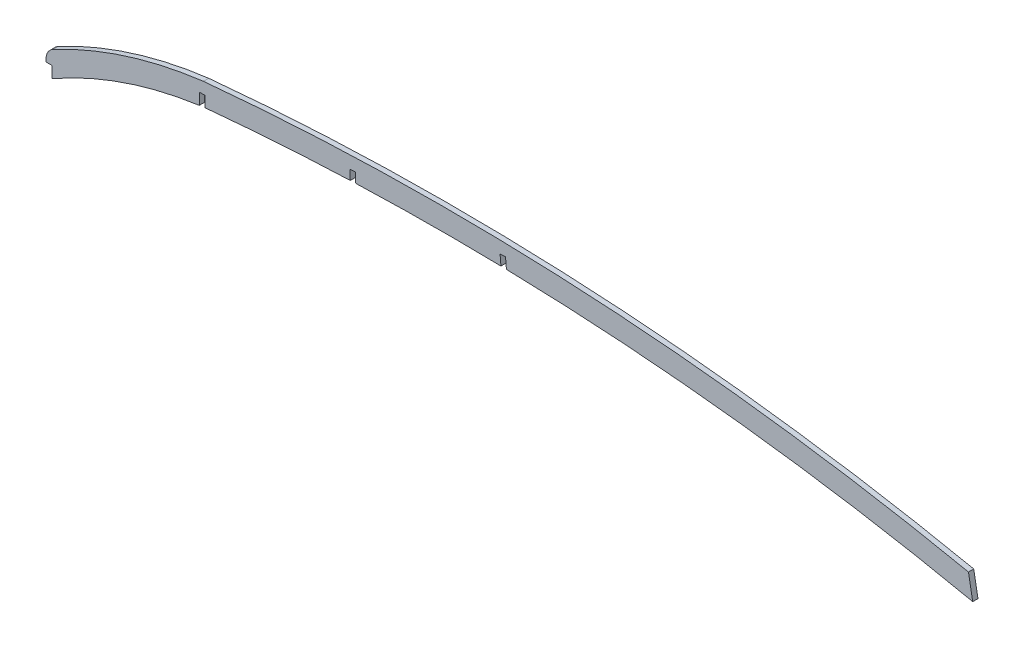
from build123d import *

# Parameters (mm, degrees)
BOSS_EXTRUDE1_DEPTH = 1.5875


with BuildPart() as part:
    # Sketch1 → Boss-Extrude1 (new, symmetric)
    with BuildSketch(Plane.XY):
        with BuildLine():
            Line((0, 101.6), (0, 100.055269774))
            Line((0, 100.055269774), (3.749926944, 100.055269774))
            Line((3.749926944, 100.055269774), (3.749926944, 93.197269774))
            ThreePointArc((3.749926944, 93.197269774), (46.592607477, 112.602219611), (92.329, 123.567152459))
            Line((92.329, 123.567152459), (92.329, 130.517973266))
            Line((92.329, 130.517973266), (95.631, 130.517973266))
            Line((95.631, 130.517973266), (95.631, 124.010897007))
            ThreePointArc((95.631, 124.010897007), (95.971054745, 124.054032816), (96.311168805, 124.096698424))
            ThreePointArc((96.311168805, 124.096698424), (139.761460521, 127.601280315), (183.294042864, 129.86495412))
            Line((183.294042864, 129.86495412), (183.050163268, 135.689672274))
            Line((183.050163268, 135.689672274), (186.349272737, 135.827805221))
            Line((186.349272737, 135.827805221), (186.59387592, 129.985805221))
            ThreePointArc((186.59387592, 129.985805221), (230.30851429, 130.913472194), (274.031797499, 130.589930281))
            Line((274.031797499, 130.589930281), (273.51809872, 136.557636124))
            Line((273.51809872, 136.557636124), (276.807932827, 136.840824305))
            Line((276.807932827, 136.840824305), (277.352525484, 130.514220253))
            ThreePointArc((277.352525484, 130.514220253), (418.553478483, 120.58290755), (558.229469453, 97.627349478))
            Line((558.229469453, 97.627349478), (555.638244479, 111.822940798))
            ThreePointArc((555.638244479, 111.822940798), (326.208122032, 141.94293007), (94.854415026, 137.375973266))
            ThreePointArc((94.854415026, 137.375973266), (48.266347056, 127.216011607), (4.300521626, 108.758517405))
            ThreePointArc((4.300521626, 108.758517405), (1.157792804, 105.775489723), (0, 101.6))
        make_face()
    extrude(amount=BOSS_EXTRUDE1_DEPTH, both=True)


solid = part.part
